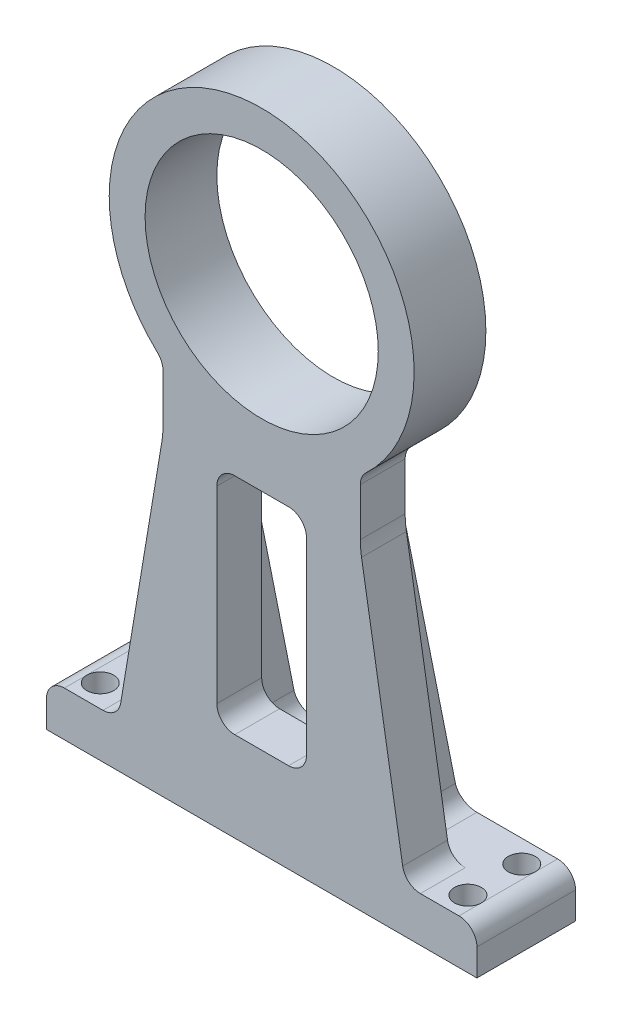
from build123d import *
from build123d.topology import SkipClean

# Parameters (mm, degrees)
SKETCH_1_R           = 13
SKETCH_1_W           = 10
SKETCH_1_H           = 25
EXTRUDE_1_DEPTH      = 2.5
EXTRUDE_2_DEPTH      = 2.5
EXTRUDE_2_DEPTH_BACK = 8.5
SKETCH_8_W           = 48
SKETCH_8_H           = 5
CUT_EXTRUDE_1_REACH  = 78.369
SKETCH_9_R           = 1.5
RIB_3_REACH          = 67.744
SKETCH_11_WALL_W     = 164.081759086
SKETCH_11_WALL_H     = 4
FILLET_1_R           = 2
FILLET_2_R           = 2
FILLET_3_R           = 10
SKETCH_12_R          = 17
SKETCH_12_R_2        = 13
EXTRUDE_3_DEPTH      = 3


# Some blends are built 0.0001 mm under size
with BuildPart() as part:
    # 草图1 → 凸台-拉伸1 (new, symmetric)
    with BuildSketch(Plane.XY):
        with BuildLine():
            Line((-24, -55), (24, -55))
            Line((24, -55), (24, -50))
            Line((24, -50), (16, -50))
            Line((16, -50), (11, -20))
            Line((11, -20), (11, -12.961481397))
            ThreePointArc((11, -12.961481397), (0, 17), (-11, -12.961481397))
            Line((-11, -12.961481397), (-11, -20))
            Line((-11, -20), (-16, -50))
            Line((-16, -50), (-24, -50))
            Line((-24, -50), (-24, -55))
        make_face()
        Circle(SKETCH_1_R, mode=Mode.SUBTRACT)
        with Locations((0, -32.5)):
            Rectangle(SKETCH_1_W, SKETCH_1_H, mode=Mode.SUBTRACT)
    extrude(amount=EXTRUDE_1_DEPTH, both=True)

    # 草图8 → 凸台-拉伸2 (add, two sides: drawn at the far end of the back side and taken through both)
    with BuildSketch(Plane.XY.offset(-EXTRUDE_2_DEPTH_BACK)):
        with Locations((0, -52.5)):
            Rectangle(SKETCH_8_W, SKETCH_8_H)
    extrude(amount=EXTRUDE_2_DEPTH + EXTRUDE_2_DEPTH_BACK)

    # 草图9 → 切除-拉伸1 (cut, up to next)
    with BuildSketch(Plane.XZ.offset(55), mode=Mode.PRIVATE) as cut_extrude_1_sk1:
        with Locations((-20.5, 0)):
            Circle(SKETCH_9_R)
    cut_extrude_1_tool1 = extrude(cut_extrude_1_sk1.sketch, amount=-CUT_EXTRUDE_1_REACH, mode=Mode.PRIVATE) & part.part
    # 草图9 → 切除-拉伸1 (cut, up to next)
    with BuildSketch(Plane.XZ.offset(55), mode=Mode.PRIVATE) as cut_extrude_1_sk2:
        with Locations(Location((20.5, 0, 0), (0, 0, 270))):
            Circle(SKETCH_9_R)
    cut_extrude_1_tool2 = extrude(cut_extrude_1_sk2.sketch, amount=-CUT_EXTRUDE_1_REACH, mode=Mode.PRIVATE) & part.part
    # 草图9 → 切除-拉伸1 (cut, up to next)
    with BuildSketch(Plane.XZ.offset(55), mode=Mode.PRIVATE) as cut_extrude_1_sk3:
        with Locations(Location((-20.5, -6, 0), (0, 0, 270))):
            Circle(SKETCH_9_R)
    cut_extrude_1_tool3 = extrude(cut_extrude_1_sk3.sketch, amount=-CUT_EXTRUDE_1_REACH, mode=Mode.PRIVATE) & part.part
    # 草图9 → 切除-拉伸1 (cut, up to next)
    with BuildSketch(Plane.XZ.offset(55), mode=Mode.PRIVATE) as cut_extrude_1_sk4:
        with Locations((20.5, -6)):
            Circle(SKETCH_9_R)
    cut_extrude_1_tool4 = extrude(cut_extrude_1_sk4.sketch, amount=-CUT_EXTRUDE_1_REACH, mode=Mode.PRIVATE) & part.part
    add(cut_extrude_1_tool1.solids().sort_by_distance((-20.5, -55, 0))[0], mode=Mode.SUBTRACT)
    add(cut_extrude_1_tool2.solids().sort_by_distance((20.5, -55, 0))[0], mode=Mode.SUBTRACT)
    add(cut_extrude_1_tool3.solids().sort_by_distance((-20.5, -55, -6))[0], mode=Mode.SUBTRACT)
    add(cut_extrude_1_tool4.solids().sort_by_distance((20.5, -55, -6))[0], mode=Mode.SUBTRACT)

    # 草图11 wall → 筋3 (add, up to next)
    with BuildSketch(Plane(origin=(-11, -35, -5.5), x_dir=(0, -0.980580675691, -0.196116135138), z_dir=(0, -0.196116135138, 0.980580675691)), mode=Mode.PRIVATE) as rib_3_sk1:
        with Locations((0, 2)):
            Rectangle(SKETCH_11_WALL_W, SKETCH_11_WALL_H)
    rib_3_tool1 = extrude(rib_3_sk1.sketch, amount=RIB_3_REACH, mode=Mode.PRIVATE) - part.part
    rib_3 = rib_3_tool1.solids().sort_by_distance((-11, -35, -5.5))[0]
    add(rib_3)

    # 镜向1: 筋3 across plane
    add(rib_3.mirror(Plane(origin=(0, 0, 0), x_dir=(0, 0, 1), z_dir=(1, 0, 0))))

    # 圆角1
    fillet_1_edges = [part.edges().sort_by_distance(p)[0] for p in [
        (11, -50, -5.5),
        (7, -50, -5.5),
        (-24, -50, -3),
        (-16, -50, 0),
        (16, -50, 0),
        (24, -50, -3),
        (5, -45, 0),
        (5, -20, 0),
        (-5, -20, 0),
        (-5, -45, 0),
        (-11, -50, -5.5),
        (-7, -50, -5.5),
    ]]
    fillet(fillet_1_edges, radius=FILLET_1_R - 0.0001)  # a hair under: the kernel refuses the full size

    # 圆角2
    fillet_2_edges = [part.edges().sort_by_distance(p)[0] for p in [
        (-11, -12.961481397, 0),
        (11, -12.961481397, 0),
    ]]
    fillet(fillet_2_edges, radius=FILLET_2_R)

    # 圆角3
    # the kernel refuses this fillet: 10 mm, written as the material it adds along each edge
    with BuildSketch(Plane(origin=(-11, -20, -2.5), x_dir=(0, 1, 0), z_dir=(0, 0, 1))) as fillet_3_piece_1:
        with BuildLine():
            CenterArc((FILLET_3_R * 0.0827625302982, FILLET_3_R), FILLET_3_R, 260.537677792, 9.462322208)
            Line((-FILLET_3_R * 0.0816364570071, FILLET_3_R * 0.0136060761679), (0, 0))
            Line((0, 0), (FILLET_3_R * 0.0827625302982, 0))
        make_face()
    extrude(amount=5)
    with BuildSketch(Plane(origin=(11, -20, -2.5), x_dir=(0, 1, 0), z_dir=(0, 0, 1))) as fillet_3_piece_2:
        with BuildLine():
            CenterArc((FILLET_3_R * 0.0827625302982, -FILLET_3_R), FILLET_3_R, 90, 9.462322208)
            Line((-FILLET_3_R * 0.0816364570071, -FILLET_3_R * 0.0136060761679), (0, 0))
            Line((0, 0), (FILLET_3_R * 0.0827625302982, 0))
        make_face()
    extrude(amount=5)

    # 草图12 → 凸台-拉伸3 (add)
    with SkipClean():  # the faces are left unmerged after this step: merging them gives an invalid solid
        with BuildSketch(Plane(origin=(0, 0, -2.5), x_dir=(-1, 0, 0), z_dir=(0, 0, -1))):
            Circle(SKETCH_12_R)
            Circle(SKETCH_12_R_2, mode=Mode.SUBTRACT)
        extrude(amount=EXTRUDE_3_DEPTH)


solid = part.part
